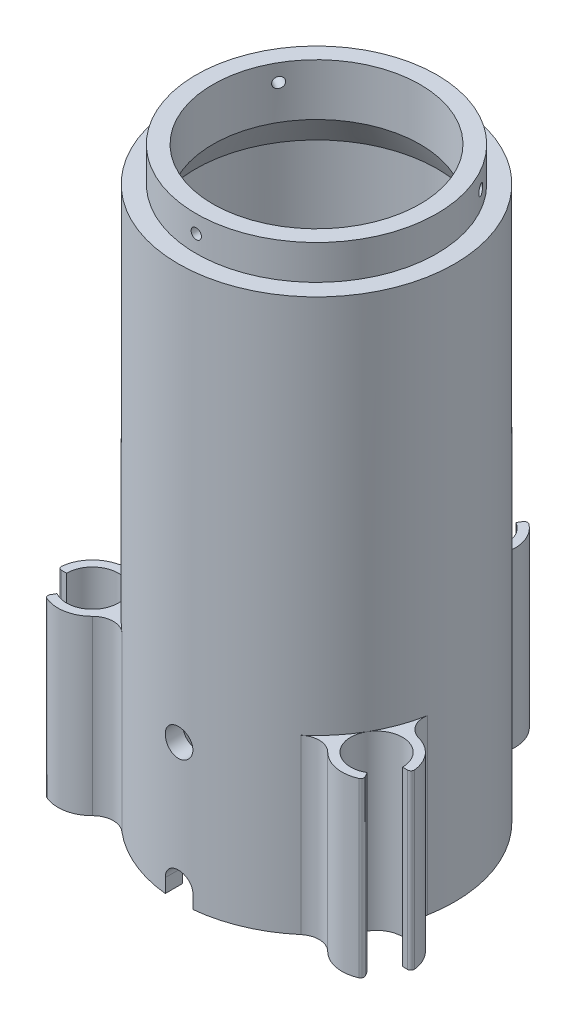
from build123d import *

# Parameters (mm, degrees)
SKETCH1_R           = 40
SKETCH1_R_2         = 35
BOSS_EXTRUDE1_DEPTH = 180
BOSS_EXTRUDE2_DEPTH = 50
SKETCH6_R           = 5.5
BOSS_EXTRUDE3_DEPTH = 8
CUT_EXTRUDE1_REACH  = 154.121
SKETCH7_R           = 1.55
SKETCH9_R           = 40
CUT_EXTRUDE2_DEPTH  = 50
CUT_EXTRUDE3_REACH  = 203.684
SKETCH11_R          = 1.5
CIRPATTERN1_COUNT   = 3
CUT_EXTRUDE4_REACH  = 203.684
SKETCH12_R          = 4


with BuildPart() as part:
    # Sketch1 → Boss-Extrude1 (new body)
    with BuildSketch(Plane(origin=(0, 0, 0), x_dir=(1, 0, 0), z_dir=(0, 1, 0))):
        Circle(SKETCH1_R)
        Circle(SKETCH1_R_2, mode=Mode.SUBTRACT)
    extrude(amount=BOSS_EXTRUDE1_DEPTH)

    # Sketch3 → Revolve1 (revolve)
    with BuildSketch(Plane(origin=(0, 0, 0), x_dir=(0, 0, -1), z_dir=(1, 0, 0))):
        with BuildLine():
            Line((-35, 180), (-40, 180))
            Line((-40, 180), (-40, 185))
            add(Edge.make_bspline(
                [(-20, 210), (-35.448934618, 201.981430701), (-40, 185)],
                knots=[0, 0, 0, 1, 1, 1], degree=2))
            Line((-20, 210), (0, 210))
            Line((0, 210), (0, 202.928932188))
            Line((0, 202.928932188), (-20, 202.928932188))
            add(Edge.make_bspline(
                [(-20, 202.928932188), (-32.989454859, 194.577869332), (-35, 180)],
                knots=[0, 0, 0, 1, 1, 1], degree=2))
        make_face()
    revolve(axis=Axis((0, -20.154872571, 0), (0, 1, 0)))

    # Sketch4 → Boss-Extrude2 (add)
    with BuildSketch(Plane(origin=(0, 0, 0), x_dir=(1, 0, 0), z_dir=(0, 1, 0))):
        with BuildLine():
            Line((4.472135955, 55.245966692), (3.75, 53.995190528))
            ThreePointArc((3.75, 53.995190528), (0, 40), (-3.75, 53.995190528))
            Line((-3.75, 53.995190528), (-4.472135955, 55.245966692))
            ThreePointArc((-4.472135955, 55.245966692), (-5.133489086, 55.72479725), (-5.931290399, 55.551074103))
            ThreePointArc((-5.931290399, 55.551074103), (-9.440614698, 50.797695275), (-9.654223492, 44.893092105))
            ThreePointArc((-9.654223492, 44.893092105), (-10.13118194, 40.546025245), (-13.431963119, 37.677345538))
            Line((-13.431963119, 37.677345538), (13.431963119, 37.677345538))
            ThreePointArc((13.431963119, 37.677345538), (10.13118194, 40.546025245), (9.654223492, 44.893092105))
            ThreePointArc((9.654223492, 44.893092105), (9.440614698, 50.797695275), (5.931290399, 55.551074103))
            ThreePointArc((5.931290399, 55.551074103), (5.133489086, 55.72479725), (4.472135955, 55.245966692))
        make_face()
        with BuildLine():
            Line((45.608342635, -31.495966692), (44.88620668, -30.245190528))
            ThreePointArc((44.88620668, -30.245190528), (34.641016151, -20), (48.63620668, -23.75))
            Line((48.63620668, -23.75), (50.08047859, -23.75))
            ThreePointArc((50.08047859, -23.75), (50.825834582, -23.416666667), (51.07428658, -22.638888889))
            ThreePointArc((51.07428658, -22.638888889), (48.712401911, -17.223035482), (43.705669963, -14.085743255))
            ThreePointArc((43.705669963, -14.085743255), (40.179478855, -11.499151692), (39.345519942, -7.206251485))
            Line((39.345519942, -7.206251485), (25.913556823, -30.471094053))
            ThreePointArc((25.913556823, -30.471094053), (30.048296914, -29.046873553), (34.051446472, -30.80734885))
            ThreePointArc((34.051446472, -30.80734885), (39.271787213, -33.574659793), (45.142996181, -32.912185214))
            ThreePointArc((45.142996181, -32.912185214), (45.692345496, -32.308130583), (45.608342635, -31.495966692))
        make_face()
        with BuildLine():
            Line((-50.08047859, -23.75), (-48.63620668, -23.75))
            ThreePointArc((-48.63620668, -23.75), (-34.641016151, -20), (-44.88620668, -30.245190528))
            Line((-44.88620668, -30.245190528), (-45.608342635, -31.495966692))
            ThreePointArc((-45.608342635, -31.495966692), (-45.692345496, -32.308130583), (-45.142996181, -32.912185214))
            ThreePointArc((-45.142996181, -32.912185214), (-39.271787213, -33.574659793), (-34.051446472, -30.80734885))
            ThreePointArc((-34.051446472, -30.80734885), (-30.048296914, -29.046873553), (-25.913556823, -30.471094053))
            Line((-25.913556823, -30.471094053), (-39.345519942, -7.206251485))
            ThreePointArc((-39.345519942, -7.206251485), (-40.179478855, -11.499151692), (-43.705669963, -14.085743255))
            ThreePointArc((-43.705669963, -14.085743255), (-48.712401911, -17.223035482), (-51.07428658, -22.638888889))
            ThreePointArc((-51.07428658, -22.638888889), (-50.825834582, -23.416666667), (-50.08047859, -23.75))
        make_face()
    extrude(amount=BOSS_EXTRUDE2_DEPTH)

    # Sketch6 → Boss-Extrude3 (add)
    with BuildSketch(Plane(origin=(0, 70, 0), x_dir=(1, 0, 0), z_dir=(0, 1, 0))):
        with BuildLine():
            Line((-5, 34.641016151), (-5, 11.456439237))
            ThreePointArc((-5, 11.456439237), (-10.458250332, 6.846531969), (-12.5, 0))
            Line((-12.5, 0), (-32.948700726, -11.806062869))
            ThreePointArc((-32.948700726, -11.806062869), (-30.310889132, -17.5), (-26.698700726, -22.631380416))
            Line((-26.698700726, -22.631380416), (-6.25, -10.825317547))
            ThreePointArc((-6.25, -10.825317547), (0, -12.5), (6.25, -10.825317547))
            Line((6.25, -10.825317547), (26.698700726, -22.631380416))
            ThreePointArc((26.698700726, -22.631380416), (30.310889132, -17.5), (32.948700726, -11.806062869))
            Line((32.948700726, -11.806062869), (12.5, 0))
            ThreePointArc((12.5, 0), (10.458250332, 6.846531969), (5, 11.456439237))
            Line((5, 11.456439237), (5, 34.641016151))
            ThreePointArc((5, 34.641016151), (0, 35), (-5, 34.641016151))
        make_face()
        Circle(SKETCH6_R, mode=Mode.SUBTRACT)
    extrude(amount=BOSS_EXTRUDE3_DEPTH)

    # Sketch7 → Cut-Extrude1 (cut, up to next)
    with BuildSketch(Plane(origin=(0, 78, 0), x_dir=(1, 0, 0), z_dir=(0, 1, 0)), mode=Mode.PRIVATE) as cut_extrude1_sk1:
        with Locations((0, 8)):
            Circle(SKETCH7_R)
    cut_extrude1_tool1 = extrude(cut_extrude1_sk1.sketch, amount=-CUT_EXTRUDE1_REACH, mode=Mode.PRIVATE) & part.part
    # Sketch7 → Cut-Extrude1 (cut, up to next)
    with BuildSketch(Plane(origin=(0, 78, 0), x_dir=(1, 0, 0), z_dir=(0, 1, 0)), mode=Mode.PRIVATE) as cut_extrude1_sk2:
        with Locations((8, 0)):
            Circle(SKETCH7_R)
    cut_extrude1_tool2 = extrude(cut_extrude1_sk2.sketch, amount=-CUT_EXTRUDE1_REACH, mode=Mode.PRIVATE) & part.part
    # Sketch7 → Cut-Extrude1 (cut, up to next)
    with BuildSketch(Plane(origin=(0, 78, 0), x_dir=(1, 0, 0), z_dir=(0, 1, 0)), mode=Mode.PRIVATE) as cut_extrude1_sk3:
        with Locations((0, -8)):
            Circle(SKETCH7_R)
    cut_extrude1_tool3 = extrude(cut_extrude1_sk3.sketch, amount=-CUT_EXTRUDE1_REACH, mode=Mode.PRIVATE) & part.part
    # Sketch7 → Cut-Extrude1 (cut, up to next)
    with BuildSketch(Plane(origin=(0, 78, 0), x_dir=(1, 0, 0), z_dir=(0, 1, 0)), mode=Mode.PRIVATE) as cut_extrude1_sk4:
        with Locations((-8, 0)):
            Circle(SKETCH7_R)
    cut_extrude1_tool4 = extrude(cut_extrude1_sk4.sketch, amount=-CUT_EXTRUDE1_REACH, mode=Mode.PRIVATE) & part.part
    add(cut_extrude1_tool1.solids().sort_by_distance((0, 78, -8))[0], mode=Mode.SUBTRACT)
    add(cut_extrude1_tool2.solids().sort_by_distance((8, 78, 0))[0], mode=Mode.SUBTRACT)
    add(cut_extrude1_tool3.solids().sort_by_distance((0, 78, 8))[0], mode=Mode.SUBTRACT)
    add(cut_extrude1_tool4.solids().sort_by_distance((-8, 78, 0))[0], mode=Mode.SUBTRACT)

    # Sketch9 → Cut-Extrude2 (cut)
    with BuildSketch(Plane(origin=(0, 210, 0), x_dir=(1, 0, 0), z_dir=(0, 1, 0))):
        Circle(SKETCH9_R)
    extrude(amount=-CUT_EXTRUDE2_DEPTH, mode=Mode.SUBTRACT)

    # Sketch10 → Revolve2 (revolve)
    with BuildSketch(Plane.XY):
        Polygon((-35, 146.339745962), (-30, 155), (-30, 170), (-34.85, 170), (-34.85, 160), (-35, 160), align=None)
    revolve(axis=Axis((0, 0, 0), (0, 1, 0)))

    # Sketch11 → Cut-Extrude3 (cut, up to next)
    with BuildSketch(Plane.XY.offset(40), mode=Mode.PRIVATE) as cut_extrude3_sk1:
        with Locations((0, 165)):
            Circle(SKETCH11_R)
    cut_extrude3_tool1 = extrude(cut_extrude3_sk1.sketch, amount=-CUT_EXTRUDE3_REACH, mode=Mode.PRIVATE) & part.part
    cut_extrude3 = cut_extrude3_tool1.solids().sort_by_distance((0, 165, 40))[0]
    add(cut_extrude3, mode=Mode.SUBTRACT)

    # CirPattern1: Cut-Extrude3 ×3 about axis
    cirpattern1_axis = Axis((0, 170, 0), (0, -1, 0))
    for i in range(1, CIRPATTERN1_COUNT):
        add(cut_extrude3.rotate(cirpattern1_axis, i * 360 / CIRPATTERN1_COUNT), mode=Mode.SUBTRACT)

    # Sketch12 → Cut-Extrude4 (cut, up to next)
    with BuildSketch(Plane.XY.offset(40), mode=Mode.PRIVATE) as cut_extrude4_sk1:
        with Locations((0, 40)):
            Circle(SKETCH12_R)
    cut_extrude4_tool1 = extrude(cut_extrude4_sk1.sketch, amount=-CUT_EXTRUDE4_REACH, mode=Mode.PRIVATE) & part.part
    # Sketch12 → Cut-Extrude4 (cut, up to next)
    with BuildSketch(Plane.XY.offset(40), mode=Mode.PRIVATE) as cut_extrude4_sk2:
        with BuildLine():
            Line((-4, 0), (4, 0))
            Line((4, 0), (4, 4))
            ThreePointArc((4, 4), (0, 8), (-4, 4))
            Line((-4, 4), (-4, 0))
        make_face()
    cut_extrude4_tool2 = extrude(cut_extrude4_sk2.sketch, amount=-CUT_EXTRUDE4_REACH, mode=Mode.PRIVATE) & part.part
    add(cut_extrude4_tool1.solids().sort_by_distance((0, 40, 40))[0], mode=Mode.SUBTRACT)
    add(cut_extrude4_tool2.solids().sort_by_distance((0, 3.626601, 40))[0], mode=Mode.SUBTRACT)


solid = part.part
